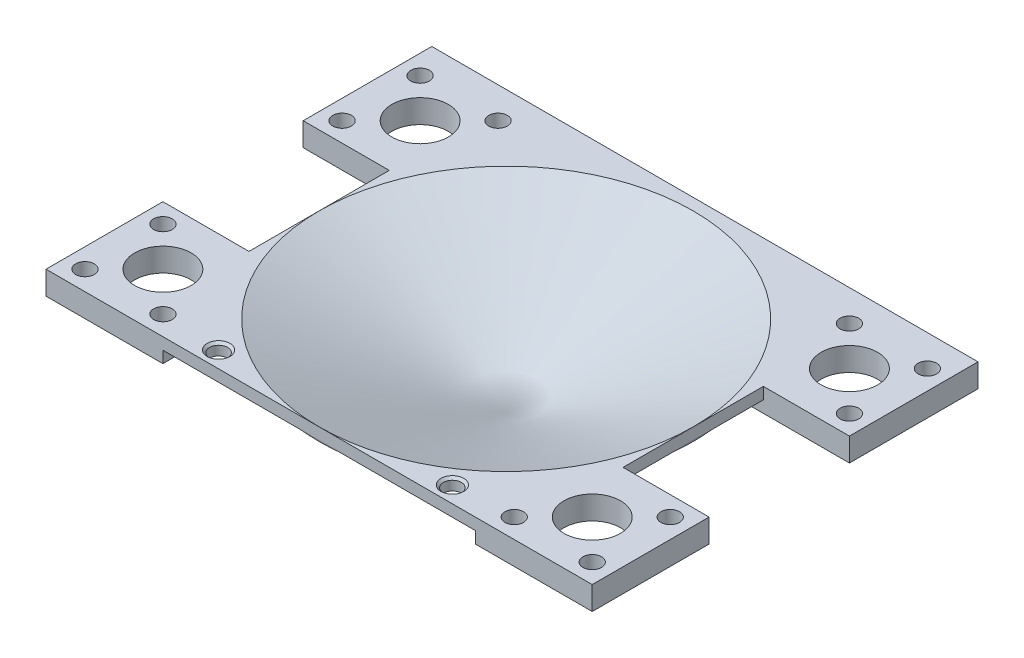
from build123d import *

# Parameters (mm, degrees)
BOSS_EXTRUDE1_START                  = -3.175
BOSS_EXTRUDE1_DEPTH                  = 3.175
BOSS_EXTRUDE2_START                  = -6.35
SKETCH4_R                            = 7.675000017
BOSS_EXTRUDE2_DEPTH                  = 6.35
SKETCH4_4_R                          = 7.675000017
CUT_EXTRUDE1_DEPTH                   = 94.422324018
F_8_0_199_DIAMETER_HOLE1_D           = 5.0546
F_8_0_199_DIAMETER_HOLE1_CSINK_D     = 6.3246
F_8_0_199_DIAMETER_HOLE1_CSINK_ANGLE = 90
MIRROR4_START                        = -6.35
MIRROR4_COPY_1_SKETCH_R              = 7.675000017
MIRROR4_COPY_1_DEPTH                 = 6.35
MIRROR4_COPY_2_SKETCH_R              = 7.675000017
MIRROR4_COPY_2_DEPTH                 = 94.422324018
MIRROR4_COPY_3_D                     = 5.0546
MIRROR4_COPY_3_CSINK_D               = 6.3246
MIRROR4_COPY_3_CSINK_ANGLE           = 90
BOSS_EXTRUDE5_DEPTH                  = 3.175
F_8_CLEARANCE_HOLE1_D                = 4.9149
F_8_CLEARANCE_HOLE1_CSINK_D          = 6.1849
F_8_CLEARANCE_HOLE1_CSINK_ANGLE      = 90


with BuildPart() as part:
    # Sketch1 → Revolve1 (revolve)
    with BuildSketch(Plane.XY):
        Polygon((0, -21.941501914), (-50.8, 0), (-50.8, -3.458498086), (0, -25.4), align=None)
    revolve(axis=Axis((0, -55, 0), (0, 1, 0)))

    # Sketch3 → Boss-Extrude1 (add)
    with BuildSketch(Plane(origin=(0, 0, 0), x_dir=(1, 0, 0), z_dir=(0, 1, 0)).offset(BOSS_EXTRUDE1_START)):
        with BuildLine():
            Line((-50.8, 8e-09), (-50.8, -50.8))
            Line((-50.8, -50.8), (0, -50.8))
            ThreePointArc((0, -50.8), (-35.921024487, -35.921024482), (-50.8, 8e-09))
        make_face()
        with BuildLine():
            ThreePointArc((50.8, 0), (35.921024484, -35.921024484), (0, -50.8))
            Line((0, -50.8), (50.8, -50.8))
            Line((50.8, -50.8), (50.8, 0))
        make_face()
        with BuildLine():
            Line((-50.8, 50.8), (-50.8, 8e-09))
            ThreePointArc((-50.8, 8e-09), (-35.921024463, 35.921024505), (5.1e-08, 50.8))
            Line((5.1e-08, 50.8), (-50.8, 50.8))
        make_face()
        with BuildLine():
            ThreePointArc((5.1e-08, 50.8), (35.921024502, 35.921024466), (50.8, 0))
            Line((50.8, 0), (50.8, 50.8))
            Line((50.8, 50.8), (5.1e-08, 50.8))
        make_face()
    extrude(amount=BOSS_EXTRUDE1_DEPTH)

    # Sketch4 → Boss-Extrude2 (add)
    with BuildSketch(Plane(origin=(0, 0, 0), x_dir=(1, 0, 0), z_dir=(0, 1, 0)).offset(BOSS_EXTRUDE2_START)):
        with BuildLine():
            ThreePointArc((-42.425, -27.942071774), (-44.979207057, -23.611669415), (-47.092860393, -19.05))
            Line((-47.092860393, -19.05), (-74.175, -19.05))
            Line((-74.175, -19.05), (-74.175, -50.8))
            Line((-74.175, -50.8), (-42.425, -50.8))
            Line((-42.425, -50.8), (-42.425, -27.942071774))
        make_face()
        with Locations((-58.3, -34.925)):
            Circle(SKETCH4_R, mode=Mode.SUBTRACT)
    boss_extrude2 = extrude(amount=BOSS_EXTRUDE2_DEPTH)

    # Sketch4<4> → Cut-Extrude1 (cut, through all)
    with BuildSketch(Plane(origin=(0, 0, 0), x_dir=(1, 0, 0), z_dir=(0, 1, 0))):
        with Locations((-58.3, -34.925)):
            Circle(SKETCH4_4_R)
    cut_extrude1 = extrude(amount=-CUT_EXTRUDE1_DEPTH, mode=Mode.SUBTRACT)

    # #8 (0.199) Diameter Hole1 (through all)
    with Locations(Plane(origin=(0, -6.35, 0), x_dir=(-1, 0, 0), z_dir=(0, -1, 0))):
        with Locations((68.889150429, -24.335849571), (68.889150429, -45.514150429), (47.710849571, -45.514150429)):
            f_8_0_199_diameter_hole1 = CounterSinkHole(F_8_0_199_DIAMETER_HOLE1_D / 2, F_8_0_199_DIAMETER_HOLE1_CSINK_D / 2, counter_sink_angle=F_8_0_199_DIAMETER_HOLE1_CSINK_ANGLE)

    # Mirror3: Boss-Extrude2, Cut-Extrude1, #8 (0.199) Diameter Hole1 across plane
    add(boss_extrude2.mirror(Plane.XY))
    add(cut_extrude1.mirror(Plane.XY), mode=Mode.SUBTRACT)
    add(f_8_0_199_diameter_hole1.mirror(Plane.XY), mode=Mode.SUBTRACT)

    # Mirror4: Boss-Extrude2, Cut-Extrude1, #8 (0.199) Diameter Hole1 across plane
    add(boss_extrude2.mirror(Plane(origin=(0, 0, 0), x_dir=(0, 0, 1), z_dir=(1, 0, 0))))
    add(cut_extrude1.mirror(Plane(origin=(0, 0, 0), x_dir=(0, 0, 1), z_dir=(1, 0, 0))), mode=Mode.SUBTRACT)
    add(f_8_0_199_diameter_hole1.mirror(Plane(origin=(0, 0, 0), x_dir=(0, 0, 1), z_dir=(1, 0, 0))), mode=Mode.SUBTRACT)

    # Mirror4 copy 1 sketch → Mirror4 copy 1 (add)
    with BuildSketch(Plane(origin=(0, 0, 0), x_dir=(-1, 0, 0), z_dir=(0, 1, 0)).offset(MIRROR4_START)):
        with BuildLine():
            ThreePointArc((-42.425, -27.942071774), (-44.979207057, -23.611669415), (-47.092860393, -19.05))
            Line((-47.092860393, -19.05), (-74.175, -19.05))
            Line((-74.175, -19.05), (-74.175, -50.8))
            Line((-74.175, -50.8), (-42.425, -50.8))
            Line((-42.425, -50.8), (-42.425, -27.942071774))
        make_face()
        with Locations((-58.3, -34.925)):
            Circle(MIRROR4_COPY_1_SKETCH_R, mode=Mode.SUBTRACT)
    extrude(amount=MIRROR4_COPY_1_DEPTH)

    # Mirror4 copy 2 sketch → Mirror4 copy 2 (cut, through all)
    with BuildSketch(Plane(origin=(0, 0, 0), x_dir=(-1, 0, 0), z_dir=(0, 1, 0))):
        with Locations((-58.3, -34.925)):
            Circle(MIRROR4_COPY_2_SKETCH_R)
    extrude(amount=-MIRROR4_COPY_2_DEPTH, mode=Mode.SUBTRACT)

    # Mirror4 copy 3 (through all)
    with Locations(Plane.XZ.offset(6.35)):
        with Locations((68.889150429, -24.335849571), (68.889150429, -45.514150429), (47.710849571, -45.514150429)):
            CounterSinkHole(MIRROR4_COPY_3_D / 2, MIRROR4_COPY_3_CSINK_D / 2, counter_sink_angle=MIRROR4_COPY_3_CSINK_ANGLE)

    # Sketch13 → Boss-Extrude5 (add)
    with BuildSketch(Plane(origin=(0, 0, -50.8), x_dir=(-1, 0, 0), z_dir=(0, 0, -1))):
        Polygon((-74.175, -6.35), (-42.425, -6.35), (-42.425, -3.175), (0, -3.175), (42.425, -3.175), (42.425, -6.35), (74.175, -6.35), (74.175, 0), (0, 0), (-74.175, 0), align=None)
    extrude(amount=BOSS_EXTRUDE5_DEPTH)

    # #8 Clearance Hole1 (through all)
    with Locations(Plane(origin=(0, 0, 0), x_dir=(1, 0, 0), z_dir=(0, 1, 0))):
        with Locations((-31.75, -46.355), (31.75, -46.355)):
            CounterSinkHole(F_8_CLEARANCE_HOLE1_D / 2, F_8_CLEARANCE_HOLE1_CSINK_D / 2, counter_sink_angle=F_8_CLEARANCE_HOLE1_CSINK_ANGLE)


solid = part.part
